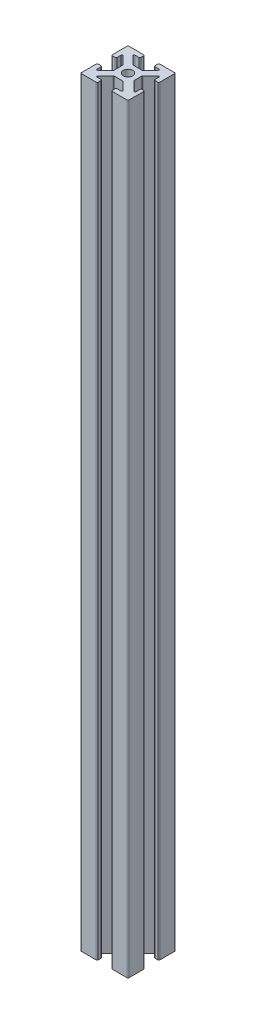
from build123d import *

# Parameters (mm, degrees)
ESQUISSE1_R                  = 2
BOSS_EXTRU_1_DEPTH           = 320
CONG_1_R                     = 0.4
ENL_V_MAT_EXTRU_1_DEPTH      = 322.247568084
ENL_V_MAT_EXTRU_1_DEPTH_BACK = 322.247568084
ESQUISSE2_R                  = 2
ENL_V_MAT_EXTRU_2_DEPTH      = 322.247568184
ENL_V_MAT_EXTRU_2_DEPTH_BACK = 322.247568184
ESQUISSE4_R                  = 2
ESQUISSE3_R                  = 2
ENL_V_MAT_EXTRU_3_DEPTH      = 322.247568184
ESQUISSE5_R                  = 2
ENL_V_MAT_EXTRU_4_DEPTH      = 321.929898987


with BuildPart() as part:
    # Esquisse1 → Boss.-Extru.1 (new body)
    with BuildSketch(Plane(origin=(0, 0, 0), x_dir=(1, 0, 0), z_dir=(0, 1, 0))):
        Polygon((0, 0), (0, 7), (2, 7), (2, 4), (6, 8), (6, 12), (2, 16), (2, 13), (0, 13), (0, 20), (7, 20), (7, 18), (4, 18), (8, 14), (12, 14), (16, 18), (13, 18), (13, 20), (20, 20), (20, 13), (18, 13), (18, 16), (14, 12), (14, 8.5), (18.5, 4), (18.5, 7), (20, 7), (20, 0), (13, 0), (13, 2), (16, 2), (12, 6), (8, 6), (4, 2), (7, 2), (7, 0), align=None)
        with Locations((10, 10)):
            Circle(ESQUISSE1_R, mode=Mode.SUBTRACT)
    extrude(amount=BOSS_EXTRU_1_DEPTH)

    # Congé1
    cong_1_edges = [part.edges().sort_by_distance(p)[0] for p in [
        (4, 160, -18),
        (2, 160, -16),
        (6, 160, -12),
        (6, 160, -8),
        (2, 160, -4),
        (2, 160, -7),
        (0, 160, -7),
        (0, 160, 0),
        (7, 160, 0),
        (7, 160, -2),
        (4, 160, -2),
        (8, 160, -6),
        (12, 160, -6),
        (16, 160, -2),
        (13, 160, -2),
        (13, 160, 0),
        (20, 160, 0),
        (20, 160, -7),
        (18.5, 160, -7),
        (18.5, 160, -4),
        (14, 160, -8.5),
        (14, 160, -12),
        (18, 160, -16),
        (18, 160, -13),
        (20, 160, -13),
        (20, 160, -20),
        (13, 160, -20),
        (13, 160, -18),
        (16, 160, -18),
        (12, 160, -14),
        (8, 160, -14),
        (7, 160, -18),
        (7, 160, -20),
        (0, 160, -20),
        (0, 160, -13),
        (2, 160, -13),
    ]]
    fillet(cong_1_edges, radius=CONG_1_R)

    # Esquisse2 → Enlèv. mat.-Extru.1 (cut, two sides: drawn at the far end of the back side and taken through both)
    with BuildSketch(Plane.XY.offset(-ENL_V_MAT_EXTRU_1_DEPTH_BACK)):
        with Locations((10, 73)):
            Circle(ESQUISSE2_R)
        with Locations((10, 51)):
            Circle(ESQUISSE2_R)
    extrude(amount=ENL_V_MAT_EXTRU_1_DEPTH + ENL_V_MAT_EXTRU_1_DEPTH_BACK, mode=Mode.SUBTRACT)

    # Esquisse4 → Enlèv. mat.-Extru.2 (cut, two sides: drawn at the far end of the back side and taken through both)
    with BuildSketch(Plane.XY.offset(-ENL_V_MAT_EXTRU_2_DEPTH_BACK)):
        with Locations((10, 139)):
            Circle(ESQUISSE4_R)
        with Locations((10, 117)):
            Circle(ESQUISSE4_R)
    extrude(amount=ENL_V_MAT_EXTRU_2_DEPTH + ENL_V_MAT_EXTRU_2_DEPTH_BACK, mode=Mode.SUBTRACT)

    # Esquisse3 → Enlèv. mat.-Extru.3 (cut, through all)
    with BuildSketch(Plane.XY):
        with Locations((10, 90)):
            Circle(ESQUISSE3_R)
        with Locations((10, 180)):
            Circle(ESQUISSE3_R)
    extrude(amount=-ENL_V_MAT_EXTRU_3_DEPTH, mode=Mode.SUBTRACT)

    # Esquisse5 → Enlèv. mat.-Extru.4 (cut, through all)
    with BuildSketch(Plane.XY.offset(-6)):
        with Locations((10, 217)):
            Circle(ESQUISSE5_R)
        with Locations((10, 195)):
            Circle(ESQUISSE5_R)
    extrude(amount=-ENL_V_MAT_EXTRU_4_DEPTH, mode=Mode.SUBTRACT)


solid = part.part
